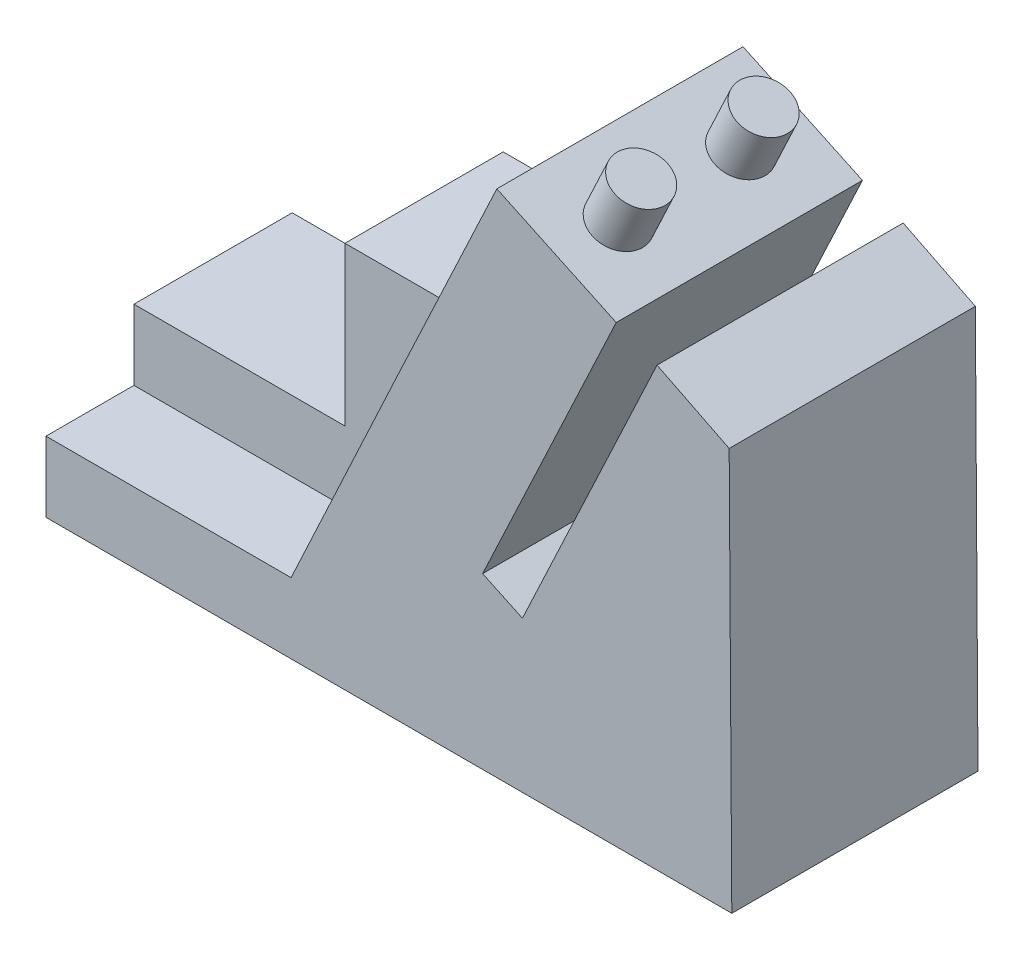
from build123d import *

# Parameters (mm, degrees)
SALIENTE_EXTRUIR1_DEPTH = 18
SALIENTE_EXTRUIR2_DEPTH = 28
CROQUIS3_R              = 3
SALIENTE_EXTRUIR3_DEPTH = 6


with BuildPart() as part:
    # Croquis1 → Saliente-Extruir1 (new body)
    with BuildSketch(Plane.XY):
        Polygon((0, 16), (0, 8), (27.876000888, 8), (40, 34), (24, 34), (24, 16), align=None)
    extrude(amount=SALIENTE_EXTRUIR1_DEPTH)

    # Croquis1<3> → Saliente-Extruir2 (add)
    with BuildSketch(Plane.XY):
        Polygon((0, 8), (0, 0), (78, 0), (77.699468189, 45.639077244), (69.495131061, 49.743829631), (54.185803195, 17.161250232), (49.660444945, 19.287545769), (64.852771548, 51.621113389), (51.276696798, 58), (40, 34), (27.876000888, 8), align=None)
    extrude(amount=SALIENTE_EXTRUIR2_DEPTH)

    # Croquis3 → Saliente-Extruir3 (add)
    with BuildSketch(Plane(origin=(31.596767843, 67.246857993, 0), x_dir=(0.9050716499680007, -0.4252591073971265, 0), z_dir=(0.4252591073971265, 0.9050716499680007, 0))):
        with Locations((29.244056347, -7)):
            Circle(CROQUIS3_R)
        with Locations((29.327705259, -21)):
            Circle(CROQUIS3_R)
    extrude(amount=SALIENTE_EXTRUIR3_DEPTH)


solid = part.part
